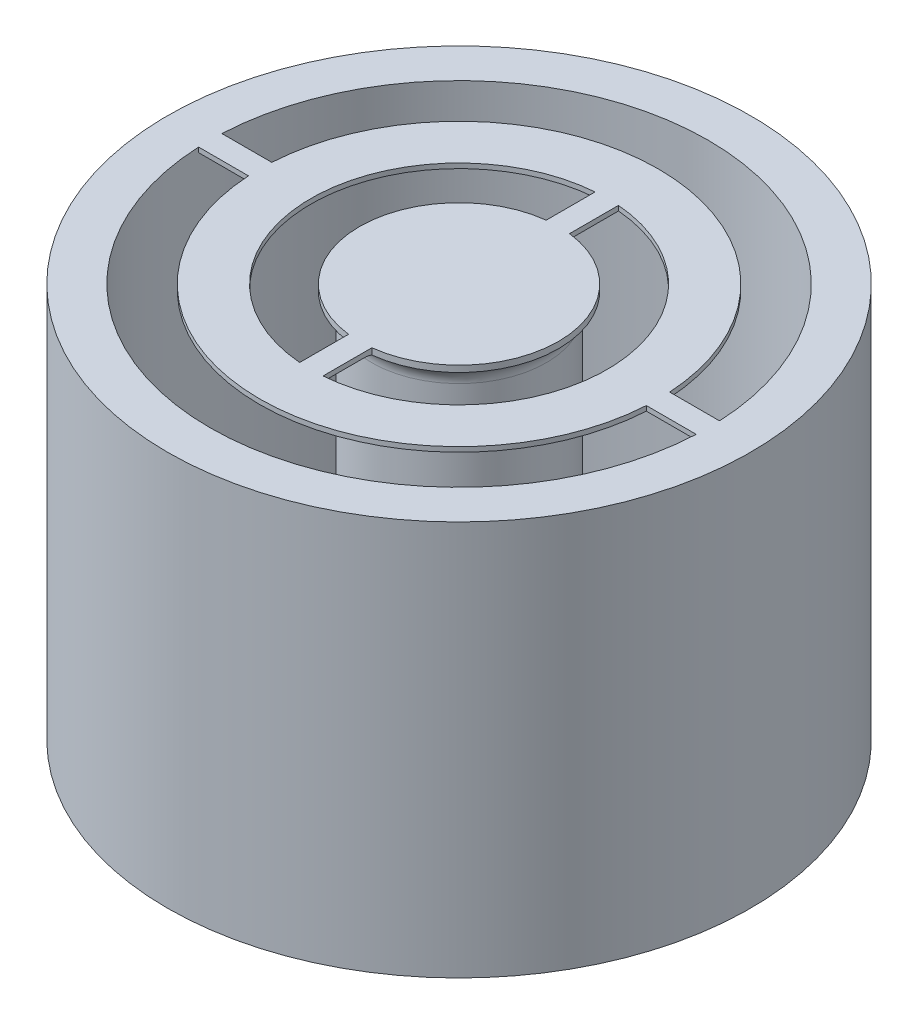
from build123d import *

# Parameters (mm, degrees)
SKETCH1_R           = 15
BOSS_EXTRUDE1_DEPTH = 0.25
BOSS_EXTRUDE2_START = -20.32
SKETCH2_R           = 15
SKETCH2_R_2         = 12.815737343
BOSS_EXTRUDE2_DEPTH = 20.32
SKETCH3_R           = 4.490128061
BOSS_EXTRUDE3_DEPTH = 19.05
FILLET2_R           = 1.016


with BuildPart() as part:
    # Sketch1 → Boss-Extrude1 (new body)
    with BuildSketch(Plane(origin=(0, 0, 0), x_dir=(1, 0, 0), z_dir=(0, 1, 0))):
        with Locations(Location((0, 0, 0), (0, 0, 270))):
            Circle(SKETCH1_R)
        with BuildLine():
            Line((-12.801684406, 0.6), (-10.235182592, 0.6))
            ThreePointArc((-10.235182592, 0.6), (0, 10.252753907), (10.235182592, 0.6))
            Line((10.235182592, 0.6), (12.801684406, 0.6))
            ThreePointArc((12.801684406, 0.6), (0, 12.815737343), (-12.801684406, 0.6))
        make_face(mode=Mode.SUBTRACT)
        with BuildLine():
            Line((-0.6, 7.600213812), (-0.6, 5.084960781))
            ThreePointArc((-0.6, 5.084960781), (-5.120236922, 0), (-0.6, -5.084960781))
            Line((-0.6, -5.084960781), (-0.6, -7.600213812))
            ThreePointArc((-0.6, -7.600213812), (-7.623860569, 0), (-0.6, 7.600213812))
        make_face(mode=Mode.SUBTRACT)
        with BuildLine():
            Line((0.6, 5.084960781), (0.6, 7.600213812))
            ThreePointArc((0.6, 7.600213812), (7.623860569, 0), (0.6, -7.600213812))
            Line((0.6, -7.600213812), (0.6, -5.084960781))
            ThreePointArc((0.6, -5.084960781), (5.120236922, 0), (0.6, 5.084960781))
        make_face(mode=Mode.SUBTRACT)
        with BuildLine():
            Line((-12.801684406, -0.6), (-10.235182592, -0.6))
            ThreePointArc((-10.235182592, -0.6), (0, -10.252753907), (10.235182592, -0.6))
            Line((10.235182592, -0.6), (12.801684406, -0.6))
            ThreePointArc((12.801684406, -0.6), (0, -12.815737343), (-12.801684406, -0.6))
        make_face(mode=Mode.SUBTRACT)
    extrude(amount=BOSS_EXTRUDE1_DEPTH)

    # Sketch2 → Boss-Extrude2 (add)
    with BuildSketch(Plane(origin=(0, 0.25, 0), x_dir=(1, 0, 0), z_dir=(0, 1, 0)).offset(BOSS_EXTRUDE2_START)):
        with Locations(Location((0, 0, 0), (0, 0, 270))):
            Circle(SKETCH2_R)
        with Locations(Location((0, 0, 0), (0, 0, 2.683422553))):
            Circle(SKETCH2_R_2, mode=Mode.SUBTRACT)
    extrude(amount=BOSS_EXTRUDE2_DEPTH)

    # Sketch3 → Boss-Extrude3 (add)
    with BuildSketch(Plane.XZ):
        with Locations(Location((0, 0, 0), (0, 0, 90))):
            Circle(SKETCH3_R)
        Polygon((-1.524, 1.524), (-1.524, 2.667), (1.524, 2.667), (1.524, 1.524), (2.667, 1.524), (2.667, -1.524), (1.524, -1.524), (1.524, -2.667), (-1.524, -2.667), (-1.524, -1.524), (-2.667, -1.524), (-2.667, 1.524), align=None, mode=Mode.SUBTRACT)
    extrude(amount=BOSS_EXTRUDE3_DEPTH)

    # Fillet2
    # the kernel refuses this fillet: 1.016 mm, written as the material it adds along each edge
    with BuildSketch(Plane(origin=(0, 0, 0), x_dir=(0, 0, 1), z_dir=(1, 0, 0))) as fillet2_piece_1_section:
        with BuildLine():
            CenterArc((4.490128061 + FILLET2_R, FILLET2_R), FILLET2_R, 180, 90)
            Line((4.490128061, FILLET2_R), (4.490128061, 0))
            Line((4.490128061, 0), (4.490128061 + FILLET2_R, 0))
        make_face()
    fillet2_piece_1 = revolve(axis=Axis((0, 0, 0), (0, -1, 0)), mode=Mode.PRIVATE)
    fillet2_piece_1 = split(fillet2_piece_1, bisect_by=Plane(origin=(0.6, -0.022686873, 5.204418355), z_dir=(-1, 0, 0)), keep=Keep.TOP, mode=Mode.PRIVATE)
    fillet2_piece_1 = split(fillet2_piece_1, bisect_by=Plane(origin=(-0.6, -0.022686873, 5.204418355), z_dir=(1, 0, 0)), keep=Keep.TOP, mode=Mode.PRIVATE)
    add(fillet2_piece_1)
    with BuildSketch(Plane(origin=(0, 0, 0), x_dir=(0, 0, 1), z_dir=(1, 0, 0))) as fillet2_piece_2_section:
        with BuildLine():
            CenterArc((4.490128061 + FILLET2_R, FILLET2_R), FILLET2_R, 180, 90)
            Line((4.490128061, FILLET2_R), (4.490128061, 0))
            Line((4.490128061, 0), (4.490128061 + FILLET2_R, 0))
        make_face()
    fillet2_piece_2 = revolve(axis=Axis((0, 0, 0), (0, -1, 0)), mode=Mode.PRIVATE)
    fillet2_piece_2 = fillet2_piece_2 & Plane(origin=(0, -0.038068082, 0), x_dir=(0.11718207753036296, 0, 0.9931104473852181), z_dir=(0, -1, 0)) * Cylinder(5.120236922, 23, mode=Mode.PRIVATE)
    add(fillet2_piece_2)


solid = part.part
